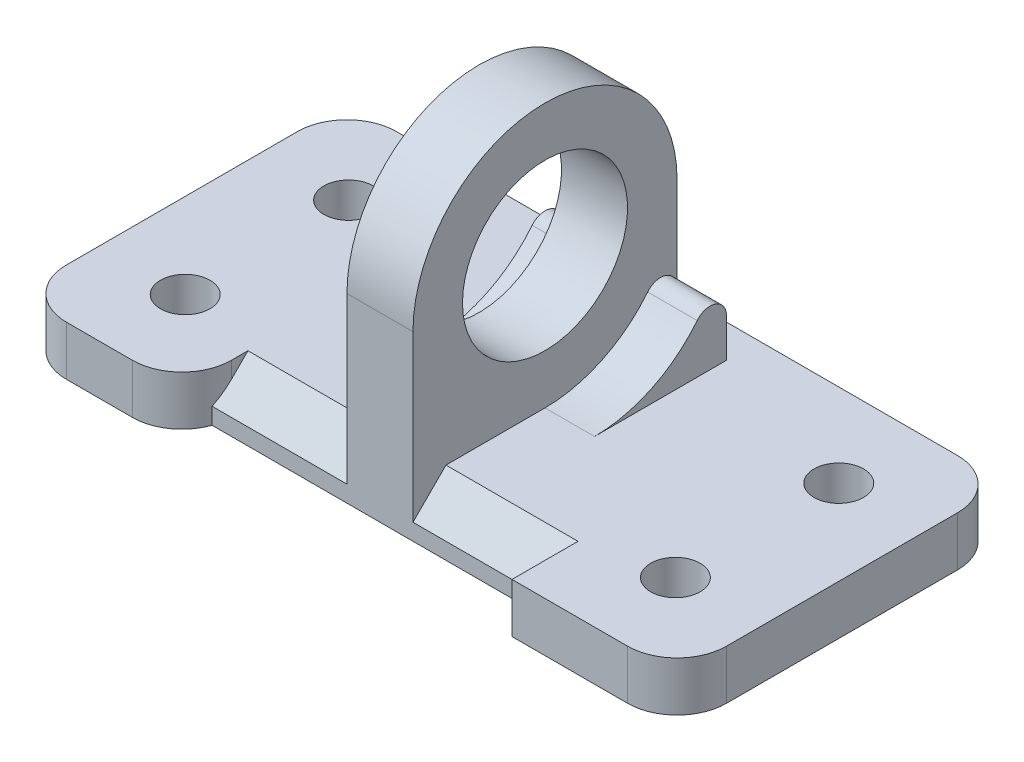
from build123d import *

# Parameters (mm, degrees)
SKETCH1_W               = 36
SKETCH1_H               = 16
BOSS_EXTRUDE1_DEPTH     = 3
SKETCH3_W               = 4
SKETCH3_H               = 16
BOSS_EXTRUDE2_DEPTH     = 16
BOSS_EXTRUDE3_DEPTH     = 3
CUT_EXTRUDE2_DEPTH      = 29.722813233
CUT_EXTRUDE2_DEPTH_BACK = 29.722813233
FILLET1_START           = -5
FILLET1_DEPTH           = 3
FILLET1_START_2         = 2
FILLET1_2_DEPTH         = 3
SKETCH7_R               = 5
CUT_EXTRUDE3_DEPTH      = 6
SKETCH8_R               = 1.5
CUT_EXTRUDE5_DEPTH      = 6
SKETCH12_W              = 36
SKETCH12_H              = 3
BOSS_EXTRUDE4_DEPTH     = 2
SKETCH13_W              = 36
SKETCH13_H              = 3
BOSS_EXTRUDE5_DEPTH     = 2
SKETCH14_W              = 20
SKETCH14_H              = 3
BOSS_EXTRUDE6_DEPTH     = 2
SKETCH15_W              = 20
SKETCH15_H              = 3
BOSS_EXTRUDE7_DEPTH     = 2
SKETCH16_W              = 20
SKETCH16_H              = 4
CUT_EXTRUDE6_DEPTH      = 6
CHAMFER1_SIZE           = 2
FILLET3_R               = 3


with BuildPart() as part:
    # Sketch1 → Boss-Extrude1 (new body)
    with BuildSketch(Plane(origin=(0, 0, 0), x_dir=(1, 0, 0), z_dir=(0, 1, 0))):
        Rectangle(SKETCH1_W, SKETCH1_H)
    extrude(amount=BOSS_EXTRUDE1_DEPTH)

    # Sketch3 → Boss-Extrude2 (add)
    with BuildSketch(Plane(origin=(0, 3, 0), x_dir=(1, 0, 0), z_dir=(0, 1, 0))):
        Rectangle(SKETCH3_W, SKETCH3_H)
    extrude(amount=BOSS_EXTRUDE2_DEPTH)

    # Sketch4 → Boss-Extrude3 (add)
    with BuildSketch(Plane.ZY.offset(2)):
        with BuildLine():
            Line((-8, 3), (1.5e-08, 3))
            ThreePointArc((1.5e-08, 3), (-5.656854244, 5.343145745), (-8, 11))
            Line((-8, 11), (-8, 3))
        make_face()
    boss_extrude3 = extrude(amount=BOSS_EXTRUDE3_DEPTH)

    # Mirror1: Boss-Extrude3 across plane
    add(boss_extrude3.mirror(Plane(origin=(0, 0, 0), x_dir=(0, 0, 1), z_dir=(1, 0, 0))))

    # Sketch6 → Cut-Extrude2 (cut, two sides: drawn at the far end of the back side and taken through both)
    with BuildSketch(Plane.ZY.offset(2).offset(-CUT_EXTRUDE2_DEPTH_BACK)):
        with BuildLine():
            Line((-8, 19), (-8, 11))
            ThreePointArc((-8, 11), (-5.656854249, 16.656854249), (0, 19))
            Line((0, 19), (-8, 19))
        make_face()
        with BuildLine():
            ThreePointArc((0, 19), (5.656854249, 16.656854249), (8, 11))
            Line((8, 11), (8, 19))
            Line((8, 19), (0, 19))
        make_face()
    extrude(amount=CUT_EXTRUDE2_DEPTH + CUT_EXTRUDE2_DEPTH_BACK, mode=Mode.SUBTRACT)

    # Fillet1: read off the stored shape, not the designer's step
    # Fillet1 outline → Fillet1 (cut)
    with BuildSketch(Plane.YZ.offset(FILLET1_START)):
        with BuildLine():
            ThreePointArc((11, -8), (8.333333334, -7.542472332), (5.971685112, -6.222222222))
            ThreePointArc((5.971685112, -6.222222222), (6.285954792, -7.333333333), (5.343145751, -8))
            Line((5.343145751, -8), (11, -8))
        make_face()
    extrude(amount=FILLET1_DEPTH, mode=Mode.SUBTRACT)

    # Fillet1 2 outline → Fillet1 2 (cut)
    with BuildSketch(Plane.YZ.offset(FILLET1_START_2)):
        with BuildLine():
            ThreePointArc((11, -8), (8.333333334, -7.542472332), (5.971685112, -6.222222222))
            ThreePointArc((5.971685112, -6.222222222), (6.285954792, -7.333333333), (5.343145751, -8))
            Line((5.343145751, -8), (11, -8))
        make_face()
    extrude(amount=FILLET1_2_DEPTH, mode=Mode.SUBTRACT)

    # Sketch7 → Cut-Extrude3 (cut)
    with BuildSketch(Plane.ZY.offset(2)):
        with Locations((0, 11)):
            Circle(SKETCH7_R)
    extrude(amount=-CUT_EXTRUDE3_DEPTH, mode=Mode.SUBTRACT)

    # Sketch8 → Cut-Extrude5 (cut)
    with BuildSketch(Plane(origin=(0, 3, 0), x_dir=(1, 0, 0), z_dir=(0, 1, 0))):
        with Locations(Location((-14.85, 4.95, 0), (0, 0, 270))):
            Circle(SKETCH8_R)
        with Locations(Location((14.85, 4.95, 0), (0, 0, 90))):
            Circle(SKETCH8_R)
        with Locations(Location((14.85, -4.95, 0), (0, 0, 270))):
            Circle(SKETCH8_R)
        with Locations(Location((-14.85, -4.95, 0), (0, 0, 90))):
            Circle(SKETCH8_R)
    extrude(amount=-CUT_EXTRUDE5_DEPTH, mode=Mode.SUBTRACT)

    # Sketch12 → Boss-Extrude4 (add)
    with BuildSketch(Plane.XY.offset(8)):
        with Locations((0, 1.5)):
            Rectangle(SKETCH12_W, SKETCH12_H)
    extrude(amount=BOSS_EXTRUDE4_DEPTH)

    # Sketch13 → Boss-Extrude5 (add)
    with BuildSketch(Plane(origin=(0, 0, -8), x_dir=(-1, 0, 0), z_dir=(0, 0, -1))):
        with Locations((0, 1.5)):
            Rectangle(SKETCH13_W, SKETCH13_H)
    extrude(amount=BOSS_EXTRUDE5_DEPTH)

    # Sketch14 → Boss-Extrude6 (add)
    with BuildSketch(Plane.ZY.offset(18)):
        with Locations((0, 1.5)):
            Rectangle(SKETCH14_W, SKETCH14_H)
    extrude(amount=BOSS_EXTRUDE6_DEPTH)

    # Sketch15 → Boss-Extrude7 (add)
    with BuildSketch(Plane(origin=(18, 0, 0), x_dir=(0, 0, -1), z_dir=(1, 0, 0))):
        with Locations((0, 1.5)):
            Rectangle(SKETCH15_W, SKETCH15_H)
    extrude(amount=BOSS_EXTRUDE7_DEPTH)

    # Sketch16 → Cut-Extrude6 (cut)
    with BuildSketch(Plane(origin=(0, 3, 0), x_dir=(1, 0, 0), z_dir=(0, 1, 0))):
        with Locations((0, -10)):
            Rectangle(SKETCH16_W, SKETCH16_H)
    extrude(amount=-CUT_EXTRUDE6_DEPTH, mode=Mode.SUBTRACT)

    # Chamfer1
    chamfer1_edges = [part.edges().sort_by_distance(p)[0] for p in [
        (6, 3, 8),
        (-6, 3, 8),
    ]]
    chamfer(chamfer1_edges, length=CHAMFER1_SIZE)

    # Fillet3
    fillet3_edges = [part.edges().sort_by_distance(p)[0] for p in [
        (-20, 1.5, -10),
        (-20, 1.5, 10),
        (20, 1.5, 10),
        (20, 1.5, -10),
        (-10, 1.5, 10),
    ]]
    fillet(fillet3_edges, radius=FILLET3_R)


solid = part.part
